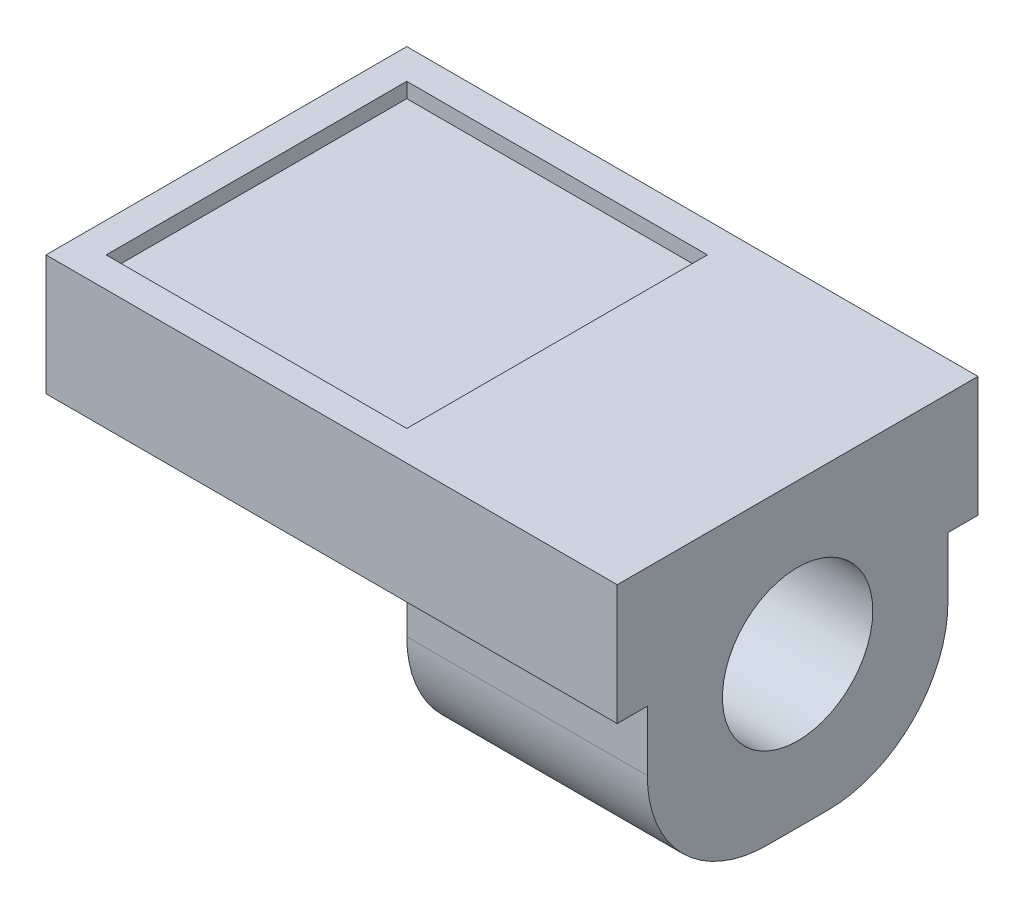
from build123d import *

# Parameters (mm, degrees)
SKETCH2_W           = 8
SKETCH2_H           = 10
BOSS_EXTRUDE1_DEPTH = 8
SKETCH4_W           = 19
SKETCH4_H           = 10
BOSS_EXTRUDE2_DEPTH = 2
SKETCH6_W           = 19
SKETCH6_H           = 4
BOSS_EXTRUDE3_DEPTH = 1
SKETCH7_W           = 1
SKETCH7_H           = 10
BOSS_EXTRUDE4_DEPTH = 2
CUT_EXTRUDE1_REACH  = 24.293
SKETCH3_R           = 2.5
CUT_EXTRUDE2_REACH  = 21
SKETCH8_R           = 1
FILLET3_R           = 4
SKETCH9_W           = 10
SKETCH9_H           = 10
CUT_EXTRUDE3_DEPTH  = 0.5


with BuildPart() as part:
    # Sketch2 → Boss-Extrude1 (new body)
    with BuildSketch(Plane(origin=(0, 0, 0), x_dir=(1, 0, 0), z_dir=(0, 1, 0))):
        Rectangle(SKETCH2_W, SKETCH2_H)
    extrude(amount=BOSS_EXTRUDE1_DEPTH)

    # Sketch4 → Boss-Extrude2 (add)
    with BuildSketch(Plane(origin=(0, 8, 0), x_dir=(1, 0, 0), z_dir=(0, 1, 0))):
        with Locations((-5.5, 0)):
            Rectangle(SKETCH4_W, SKETCH4_H)
    extrude(amount=BOSS_EXTRUDE2_DEPTH)

    # Sketch6 → Boss-Extrude3 (add)
    with BuildSketch(Plane.XY.offset(5)):
        with Locations((-5.5, 8)):
            Rectangle(SKETCH6_W, SKETCH6_H)
    boss_extrude3 = extrude(amount=BOSS_EXTRUDE3_DEPTH)

    # Mirror1: Boss-Extrude3 across plane
    add(boss_extrude3.mirror(Plane.XY))

    # Sketch7 → Boss-Extrude4 (add)
    with BuildSketch(Plane.XZ.offset(-8)):
        with Locations((-14.5, 0)):
            Rectangle(SKETCH7_W, SKETCH7_H)
    extrude(amount=BOSS_EXTRUDE4_DEPTH)

    # Sketch3 → Cut-Extrude1 (cut, up to next)
    with BuildSketch(Plane(origin=(4, 0, 0), x_dir=(0, 0, -1), z_dir=(1, 0, 0)), mode=Mode.PRIVATE) as cut_extrude1_sk1:
        with Locations((0, 5)):
            Circle(SKETCH3_R)
    cut_extrude1_tool1 = extrude(cut_extrude1_sk1.sketch, amount=-CUT_EXTRUDE1_REACH, mode=Mode.PRIVATE) & part.part
    add(cut_extrude1_tool1.solids().sort_by_distance((4, 5, 0))[0], mode=Mode.SUBTRACT)

    # Sketch8 → Cut-Extrude2 (cut, up to next)
    with BuildSketch(Plane.XZ, mode=Mode.PRIVATE) as cut_extrude2_sk1:
        Circle(SKETCH8_R)
    cut_extrude2_tool1 = extrude(cut_extrude2_sk1.sketch, amount=-CUT_EXTRUDE2_REACH, mode=Mode.PRIVATE) & part.part
    add(cut_extrude2_tool1.solids().sort_by_distance((0, 0, 0))[0], mode=Mode.SUBTRACT)

    # Fillet3
    fillet3_edges = [part.edges().sort_by_distance(p)[0] for p in [
        (0, 0, 5),
        (0, 0, -5),
    ]]
    fillet(fillet3_edges, radius=FILLET3_R)

    # Sketch9 → Cut-Extrude3 (cut)
    with BuildSketch(Plane(origin=(0, 10, 0), x_dir=(1, 0, 0), z_dir=(0, 1, 0))):
        with Locations((-9, 0)):
            Rectangle(SKETCH9_W, SKETCH9_H)
    extrude(amount=-CUT_EXTRUDE3_DEPTH, mode=Mode.SUBTRACT)


solid = part.part
